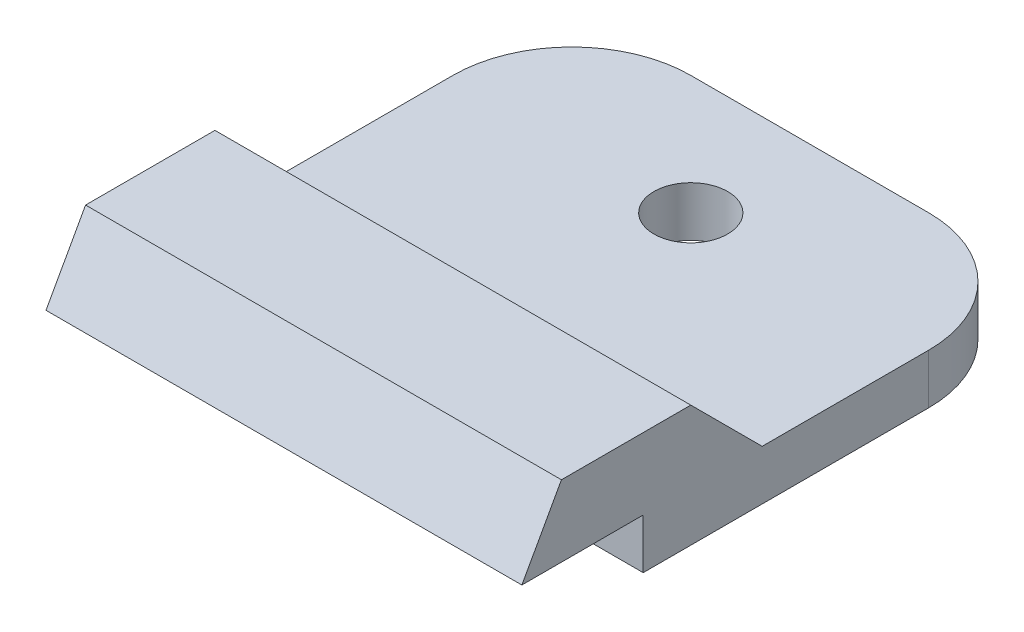
from build123d import *

# Parameters (mm, degrees)
SKETCH1_W           = 7.1
SKETCH1_H           = 3
BOSS_EXTRUDE1_DEPTH = 20
SKETCH2_R           = 1.55
CUT_EXTRUDE1_DEPTH  = 20
FILLET1_R           = 5
CHAMFER1_SIZE       = 3
CHAMFER2_SIZE       = 1.662927154
CHAMFER2_SIZE_2     = 3


# Some blends are built 0.0001 mm under size
with BuildPart() as part:
    # Sketch1 → Boss-Extrude1 (new body)
    with BuildSketch(Plane(origin=(0, 0, 0), x_dir=(0, 0, -1), z_dir=(1, 0, 0))):
        with Locations((3.55, -1.5)):
            Rectangle(SKETCH1_W, SKETCH1_H)
        Polygon((22.1, -3), (7.1, -3), (5.1, -3), (5.1, -5.1), (22.1, -5.1), align=None)
    extrude(amount=BOSS_EXTRUDE1_DEPTH)

    # Sketch2 → Cut-Extrude1 (cut)
    with BuildSketch(Plane(origin=(0, -3, 0), x_dir=(1, 0, 0), z_dir=(0, 1, 0))):
        with Locations(Location((10, 17.1, 0), (0, 0, 270))):
            Circle(SKETCH2_R)
    extrude(amount=-CUT_EXTRUDE1_DEPTH, mode=Mode.SUBTRACT)

    # Fillet1
    fillet1_edges = [part.edges().sort_by_distance(p)[0] for p in [
        (0, -4.05, -22.1),
        (20, -4.05, -22.1),
    ]]
    fillet(fillet1_edges, radius=FILLET1_R)

    # Chamfer1
    chamfer1_edges = [part.edges().sort_by_distance(p)[0] for p in [
        (10, -3, -7.1),
    ]]
    chamfer(chamfer1_edges, length=CHAMFER1_SIZE - 0.0001)  # a hair under: the kernel refuses the full size

    # Chamfer2
    # the kernel refuses this chamfer: 3, 1.662927154 mm, written as the material it takes off along each edge
    with BuildSketch(Plane(origin=(-7.763748365, 0, 0), x_dir=(0, 0.06086775916528878, -0.9981458389905739), z_dir=(1, 0, 0))) as chamfer2_piece_1:
        Polygon((CHAMFER2_SIZE * 0.998145839206, -CHAMFER2_SIZE * 0.0608677591784), (-CHAMFER2_SIZE_2 * 0.0608677591653, -CHAMFER2_SIZE_2 * 0.998145838991), (0, 0), align=None)
    extrude(amount=35.527496731, mode=Mode.SUBTRACT)


solid = part.part
